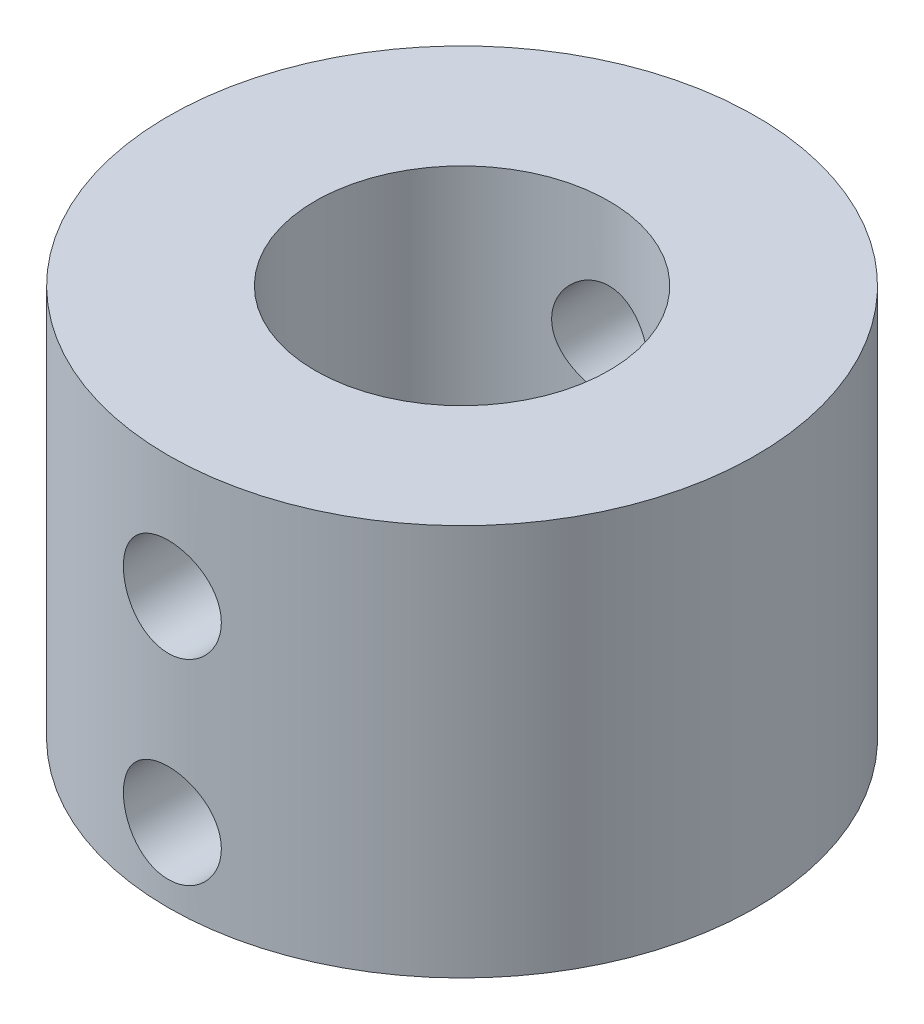
from build123d import *

# Parameters (mm, degrees)
SKETCH1_R              = 6
SKETCH1_R_2            = 3
BOSS_EXTRUDE1_DEPTH    = 8
CUT_EXTRUDE1_START     = -6.000000101
CUT_EXTRUDE1_OUTLINE_R = 1
CUT_EXTRUDE1_DEPTH     = 12.000000201


# Read off the part's stored shape, not the designer's step: Cut-Extrude1
with BuildPart() as part:
    # Sketch1 → Boss-Extrude1 (new body)
    with BuildSketch(Plane(origin=(0, 0, 0), x_dir=(1, 0, 0), z_dir=(0, 1, 0))):
        with Locations(Location((0, 0, 0), (0, 0, 270))):
            Circle(SKETCH1_R)
        with Locations(Location((0, 0, 0), (0, 0, 270))):
            Circle(SKETCH1_R_2, mode=Mode.SUBTRACT)
    extrude(amount=BOSS_EXTRUDE1_DEPTH)

    # Cut-Extrude1 outline → Cut-Extrude1 (cut)
    with BuildSketch(Plane.XY.offset(CUT_EXTRUDE1_START)):
        with Locations((0, 1.5)):
            Circle(CUT_EXTRUDE1_OUTLINE_R)
        with Locations((0, 5.5)):
            Circle(CUT_EXTRUDE1_OUTLINE_R)
    extrude(amount=CUT_EXTRUDE1_DEPTH, mode=Mode.SUBTRACT)


solid = part.part
